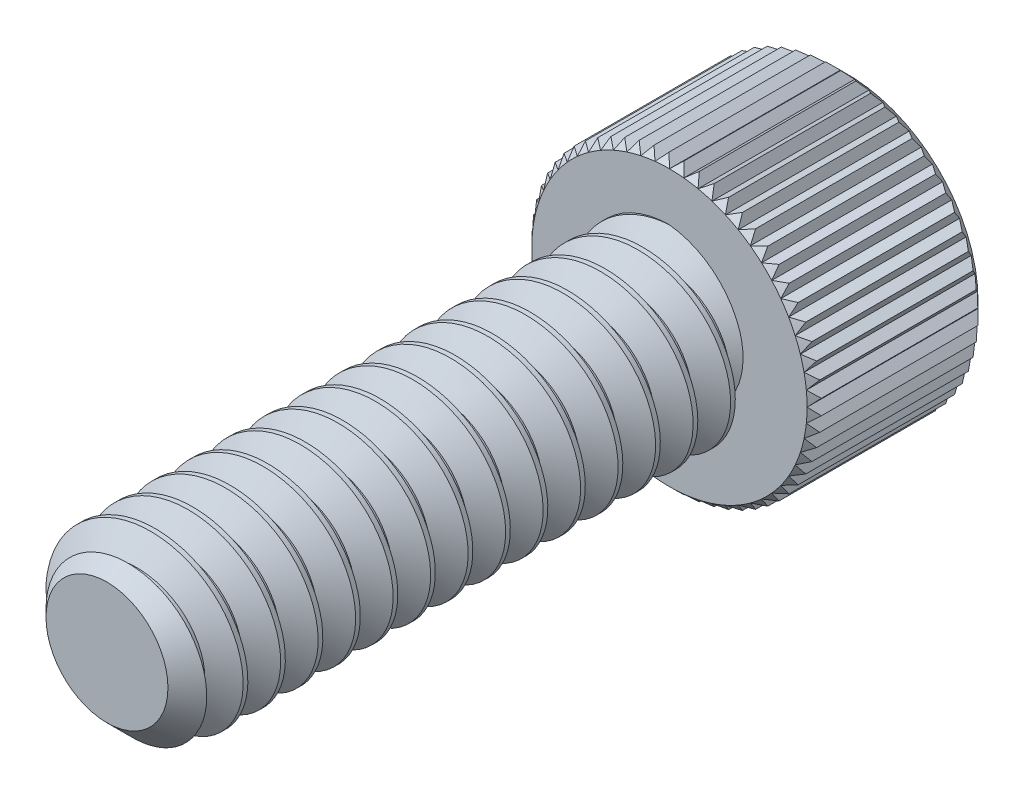
from build123d import *
from build123d.topology import SkipClean

# Parameters (mm, degrees)
SKETCH1_R          = 1.2573
EXTRUDE1_DEPTH     = 7.9375
CHAMFER3_SIZE      = 0.396875
CUT_SWEEP1_PITCH   = 0.529166667
SKETCH6_R          = 2.0447
EXTRUDE2_DEPTH     = 2.5146
CUT_EXTRUDE1_DEPTH = 1.48828125
CHAMFER1_SIZE      = 0.20447
CHAMFER2_SIZE      = 0.102235
CUT_EXTRUDE3_DEPTH = 9.447810605
CIRPATTERN1_COUNT  = 60


with BuildPart() as part:
    # Sketch1 → Extrude1 (new body)
    with BuildSketch(Plane.XY):
        Circle(SKETCH1_R)
    extrude(amount=-EXTRUDE1_DEPTH)

    # Chamfer3
    chamfer3_edges = [part.edges().sort_by_distance(p)[0] for p in [
        (-1.2573, 0, 0),
    ]]
    chamfer(chamfer3_edges, length=CHAMFER3_SIZE)

    # Cut-Sweep1: the profile of Sketch3 profile screwed along a right-hand helix of 16 turns, 6 arcs to a turn; built about Z, then put on its axis
    cut_sweep1_z = Axis((0, 0, 0), (0, 0, 1))
    cut_sweep1_corners = [(1.2576, 0, -0.463194038), (0.913596168, 0, -0.264583333), (0.913596168, 0, -0.1984375), (1.2576, 0, 0.000173205)]
    with BuildLine(mode=Mode.PRIVATE) as cut_sweep1_profile:
        Line(cut_sweep1_corners[0], cut_sweep1_corners[1])
        Line(cut_sweep1_corners[1], cut_sweep1_corners[2])
        Line(cut_sweep1_corners[2], cut_sweep1_corners[3])
        Line(cut_sweep1_corners[3], cut_sweep1_corners[0])
    cut_sweep1_cap = Face(cut_sweep1_profile.wire())
    cut_sweep1_turn_angles = [0, 30, 60, 90, 120, 150, 180, 210, 240, 270, 300, 330, 360]
    cut_sweep1_turn_weights = [1, 0.8660254037844387, 1, 0.8660254037844387, 1, 0.8660254037844387, 1, 0.8660254037844387, 1, 0.8660254037844387, 1, 0.8660254037844387, 1]
    cut_sweep1_turn_rails = [Edge.make_bspline([Vector(p[0], p[1], 0).rotate(cut_sweep1_z, cut_sweep1_turn_angles[k]) / cut_sweep1_turn_weights[k] + Vector(0, 0, p[2] + CUT_SWEEP1_PITCH * cut_sweep1_turn_angles[k] / 360) for k in range(13)], [0, 0, 0, 1, 1, 2, 2, 3, 3, 4, 4, 5, 5, 6, 6, 6], 2, cut_sweep1_turn_weights) for p in cut_sweep1_corners]
    cut_sweep1_turn_sides = [Face.make_surface_from_curves(cut_sweep1_turn_rails[p[0]], cut_sweep1_turn_rails[p[1]]) for p in [(0, 1), (1, 2), (2, 3), (3, 0)]]
    cut_sweep1 = Plane(origin=(0, 0, 0), x_dir=(0, 1, 0), z_dir=(0, 0, -1)) * Solid(Shell([*[p.moved(Location((0, 0, CUT_SWEEP1_PITCH * i))) for i in range(16) for p in cut_sweep1_turn_sides], cut_sweep1_cap, cut_sweep1_cap.rotate(cut_sweep1_z, 5760).moved(Location((0, 0, CUT_SWEEP1_PITCH * 5760 / 360)))]))
    add(cut_sweep1, mode=Mode.SUBTRACT)

    # Sketch6 → Extrude2 (add)
    with BuildSketch(Plane(origin=(0, 0, -7.9375), x_dir=(-1, 0, 0), z_dir=(0, 0, -1))):
        Circle(SKETCH6_R)
    extrude(amount=EXTRUDE2_DEPTH)

    # Sketch7 → Cut-Extrude1 (cut)
    with BuildSketch(Plane(origin=(0, 0, -10.4521), x_dir=(-1, 0, 0), z_dir=(0, 0, -1))):
        Polygon((0, 1.14567944), (-0.9921875, 0.57283972), (-0.9921875, -0.57283972), (0, -1.14567944), (0.9921875, -0.57283972), (0.9921875, 0.57283972), align=None)
    extrude(amount=-CUT_EXTRUDE1_DEPTH, mode=Mode.SUBTRACT)

    # Cut-Extrude2 cone 1 section (through the dimple's axis) → Cut-Extrude2 (revolve, cut)
    with BuildSketch(Plane(origin=(0, 0, -10.4521), x_dir=(0, 1, 0), z_dir=(1, 0, 0))):
        Polygon((0, 0), (1.14567944, 0), (0, 1.14567944), align=None)
    revolve(axis=Axis((0, 0, -10.4521), (0, 0, 1)), mode=Mode.SUBTRACT)

    # Chamfer1
    chamfer1_edges = [part.edges().sort_by_distance(p)[0] for p in [
        (2.0447, 0, -10.4521),
    ]]
    chamfer(chamfer1_edges, length=CHAMFER1_SIZE)

    # Chamfer2
    chamfer2_edges = [part.edges().sort_by_distance(p)[0] for p in [
        (2.0447, 0, -7.9375),
    ]]
    chamfer(chamfer2_edges, length=CHAMFER2_SIZE)

    # Sketch10 → Cut-Extrude3 (cut, through all)
    with SkipClean():  # the faces are left unmerged after this step: merging them gives an invalid solid
        with BuildSketch(Plane.XY.offset(-7.9375)):
            Polygon((-0.220054192, 2.146935), (0, 1.942465), (0.220054192, 2.146935), align=None)
        cut_extrude3 = extrude(amount=-CUT_EXTRUDE3_DEPTH, mode=Mode.SUBTRACT)

    # CirPattern1: Cut-Extrude3 ×60 about axis
    cirpattern1_axis = Axis((0, 0, 0), (0, 0, 1))
    for i in range(1, CIRPATTERN1_COUNT):
        add(cut_extrude3.rotate(cirpattern1_axis, i * 360 / CIRPATTERN1_COUNT), mode=Mode.SUBTRACT)


solid = part.part
